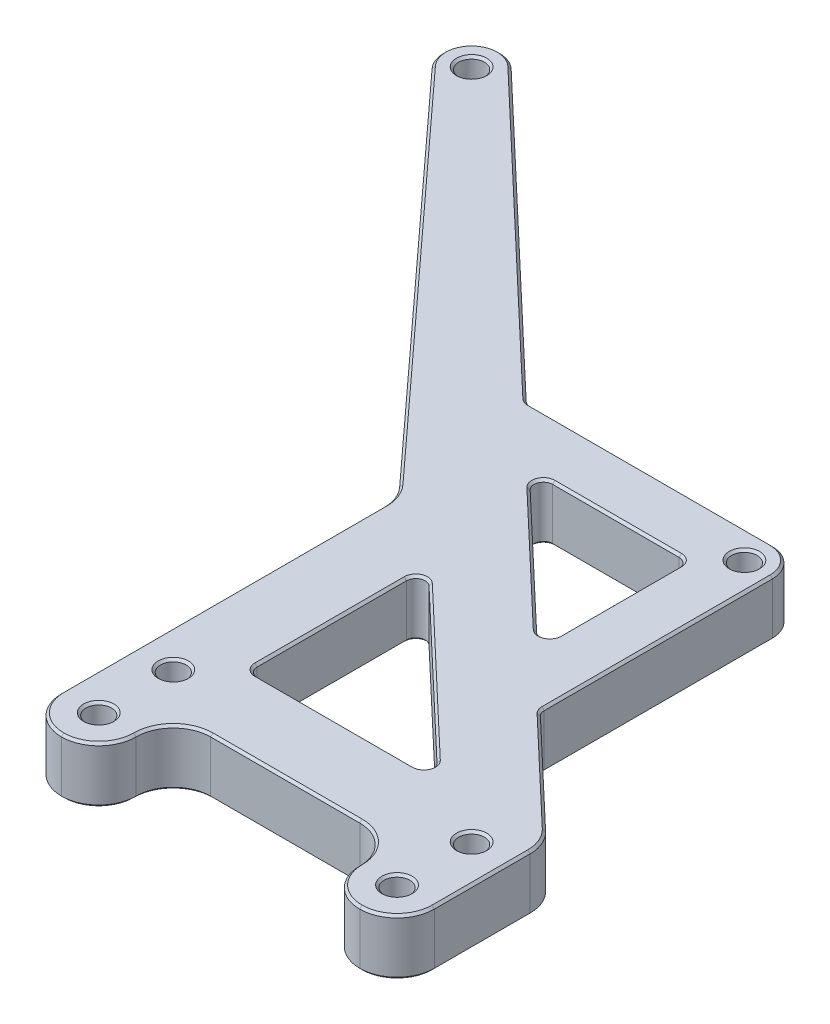
from build123d import *

# Parameters (mm, degrees)
SKETCH1_R           = 2.1828125
BOSS_EXTRUDE1_DEPTH = 9.525
CHAMFER1_SIZE       = 0.396875


with BuildPart() as part:
    # Sketch1 → Boss-Extrude1 (new body)
    with BuildSketch(Plane(origin=(0, 0, 0), x_dir=(1, 0, 0), z_dir=(0, 1, 0))):
        with BuildLine():
            Line((-6.35, 0), (-6.35, 54.968986339))
            ThreePointArc((-6.35, 54.968986339), (-6.780470884, 57.267175854), (-8.013519701, 59.253773662))
            Line((-8.013519701, 59.253773662), (-67.014860224, 123.786409508))
            ThreePointArc((-67.014860224, 123.786409508), (-66.836015353, 130.398883319), (-60.221355188, 130.454257437))
            Line((-60.221355188, 130.454257437), (-9.889535454, 82.681280854))
            ThreePointArc((-9.889535454, 82.681280854), (-9.384989789, 82.358245161), (-8.79665385, 82.2452))
            Line((-8.79665385, 82.2452), (32.4739, 82.2452))
            ThreePointArc((32.4739, 82.2452), (35.841496045, 80.850296045), (37.2364, 77.4827))
            Line((37.2364, 77.4827), (37.2364, 38.633149974))
            ThreePointArc((37.2364, 38.633149974), (37.365286652, 38.006569292), (37.731018396, 37.481730829))
            Line((37.731018396, 37.481730829), (55.171526417, 20.927889031))
            ThreePointArc((55.171526417, 20.927889031), (56.634453391, 18.828535178), (57.15, 16.322212447))
            Line((57.15, 16.322212447), (57.15, 0))
            ThreePointArc((57.15, 0), (55.290128061, -4.490128061), (50.8, -6.35))
            ThreePointArc((50.8, -6.35), (46.309797545, -4.490202455), (44.45, -0.000254))
            ThreePointArc((44.45, -0.000254), (42.590202455, 4.490202455), (38.100254, 6.35))
            Line((38.100254, 6.35), (12.699746, 6.35))
            ThreePointArc((12.699746, 6.35), (8.209797545, 4.490202455), (6.35, 0.000254))
            ThreePointArc((6.35, 0.000254), (4.490202455, -4.490202455), (0.000254, -6.35))
            ThreePointArc((0.000254, -6.35), (-4.490128061, -4.490128061), (-6.35, 0))
        make_face()
        Circle(SKETCH1_R, mode=Mode.SUBTRACT)
        with Locations((50.8, 12.7)):
            Circle(SKETCH1_R, mode=Mode.SUBTRACT)
        with Locations((-63.5, 127)):
            Circle(SKETCH1_R, mode=Mode.SUBTRACT)
        with Locations((0, 12.7)):
            Circle(SKETCH1_R, mode=Mode.SUBTRACT)
        with Locations((50.8, 0)):
            Circle(SKETCH1_R, mode=Mode.SUBTRACT)
        with Locations((32.4739, 77.4827)):
            Circle(SKETCH1_R, mode=Mode.SUBTRACT)
        with BuildLine():
            Line((35.81658762, 21.788919146), (9.030381604, 47.213328586))
            ThreePointArc((9.030381604, 47.213328586), (7.310919317, 47.520522788), (6.35, 46.06190944))
            Line((6.35, 46.06190944), (6.35, 20.6375))
            ThreePointArc((6.35, 20.6375), (6.814967985, 19.514967985), (7.9375, 19.05))
            Line((7.9375, 19.05), (34.723706016, 19.05))
            ThreePointArc((34.723706016, 19.05), (36.198160855, 20.04916406), (35.81658762, 21.788919146))
        make_face(mode=Mode.SUBTRACT)
        with BuildLine():
            Line((27.7114, 71.1327), (27.7114, 50.687488677))
            ThreePointArc((27.7114, 50.687488677), (26.750480683, 49.22887533), (25.031018396, 49.536069532))
            Line((25.031018396, 49.536069532), (3.490709118, 69.981280854))
            ThreePointArc((3.490709118, 69.981280854), (3.109135884, 71.72103594), (4.583590722, 72.7202))
            Line((4.583590722, 72.7202), (26.1239, 72.7202))
            ThreePointArc((26.1239, 72.7202), (27.246432015, 72.255232015), (27.7114, 71.1327))
        make_face(mode=Mode.SUBTRACT)
    extrude(amount=BOSS_EXTRUDE1_DEPTH)

    # Chamfer1
    chamfer1_edges = [part.edges().sort_by_distance(p)[0] for p in [
        (7.310919317, 9.525, -47.520522788),
        (6.35, 9.525, -33.34970472),
        (6.814967985, 9.525, -19.514967985),
        (21.330603008, 9.525, -19.05),
        (36.198160855, 9.525, -20.04916406),
        (22.423484612, 9.525, -34.501123866),
        (48.6171875, 9.525, 0),
        (-65.6828125, 9.525, -127),
        (-2.1828125, 9.525, 0),
        (46.309887349, 9.525, 4.490292258),
        (46.309887349, 9.525, 4.490292258),
        (42.59038206, 9.525, -4.490022844),
        (42.59038206, 9.525, -4.490022844),
        (25.4, 9.525, -6.35),
        (8.209797545, 9.525, -4.490202455),
        (4.49038206, 9.525, 4.490022844),
        (4.49038206, 9.525, 4.490022844),
        (-4.490038256, 9.525, 4.490217863),
        (-4.490038256, 9.525, 4.490217863),
        (-6.35, 9.525, -27.484493169),
        (-6.780470884, 9.525, -57.267175854),
        (-37.514189963, 9.525, -91.520091585),
        (-66.836015353, 9.525, -130.398883319),
        (-35.055445321, 9.525, -106.567769146),
        (56.634453391, 9.525, -18.828535178),
        (57.15, 9.525, -8.161106224),
        (55.290128061, 9.525, 4.490128061),
        (48.6171875, 9.525, -12.7),
        (-2.1828125, 9.525, -12.7),
        (21.330603008, 0, -19.05),
        (6.814967985, 0, -19.514967985),
        (6.35, 0, -33.34970472),
        (7.310919317, 0, -47.520522788),
        (22.423484612, 0, -34.501123866),
        (36.198160855, 0, -20.04916406),
        (57.15, 0, -8.161106224),
        (56.634453391, 0, -18.828535178),
        (-35.055445321, 0, -106.567769146),
        (-66.836015353, 0, -130.398883319),
        (-37.514189963, 0, -91.520091585),
        (-6.780470884, 0, -57.267175854),
        (-6.35, 0, -27.484493169),
        (-4.490038256, 0, 4.490217863),
        (-4.490038256, 0, 4.490217863),
        (4.49038206, 0, 4.490022844),
        (4.49038206, 0, 4.490022844),
        (8.209797545, 0, -4.490202455),
        (25.4, 0, -6.35),
        (42.59038206, 0, -4.490022844),
        (42.59038206, 0, -4.490022844),
        (46.309887349, 0, 4.490292258),
        (46.309887349, 0, 4.490292258),
        (55.290128061, 0, 4.490128061),
        (-65.6828125, 0, -127),
        (-2.1828125, 0, 0),
        (48.6171875, 0, -12.7),
        (-2.1828125, 0, -12.7),
        (48.6171875, 0, 0),
        (26.750480683, 9.525, -49.22887533),
        (27.7114, 9.525, -60.910094339),
        (27.246432015, 9.525, -72.255232015),
        (15.353745361, 9.525, -72.7202),
        (3.109135884, 9.525, -71.72103594),
        (14.260863757, 9.525, -59.758675193),
        (30.2910875, 9.525, -77.4827),
        (-9.384989789, 9.525, -82.358245161),
        (11.838623075, 9.525, -82.2452),
        (35.841496045, 9.525, -80.850296045),
        (37.2364, 9.525, -58.057924987),
        (37.365286652, 9.525, -38.006569292),
        (46.451272406, 9.525, -29.20480993),
        (15.353745361, 0, -72.7202),
        (27.246432015, 0, -72.255232015),
        (27.7114, 0, -60.910094339),
        (26.750480683, 0, -49.22887533),
        (14.260863757, 0, -59.758675193),
        (3.109135884, 0, -71.72103594),
        (46.451272406, 0, -29.20480993),
        (37.365286652, 0, -38.006569292),
        (37.2364, 0, -58.057924987),
        (35.841496045, 0, -80.850296045),
        (11.838623075, 0, -82.2452),
        (-9.384989789, 0, -82.358245161),
        (30.2910875, 0, -77.4827),
    ]]
    chamfer(chamfer1_edges, length=CHAMFER1_SIZE)


solid = part.part
